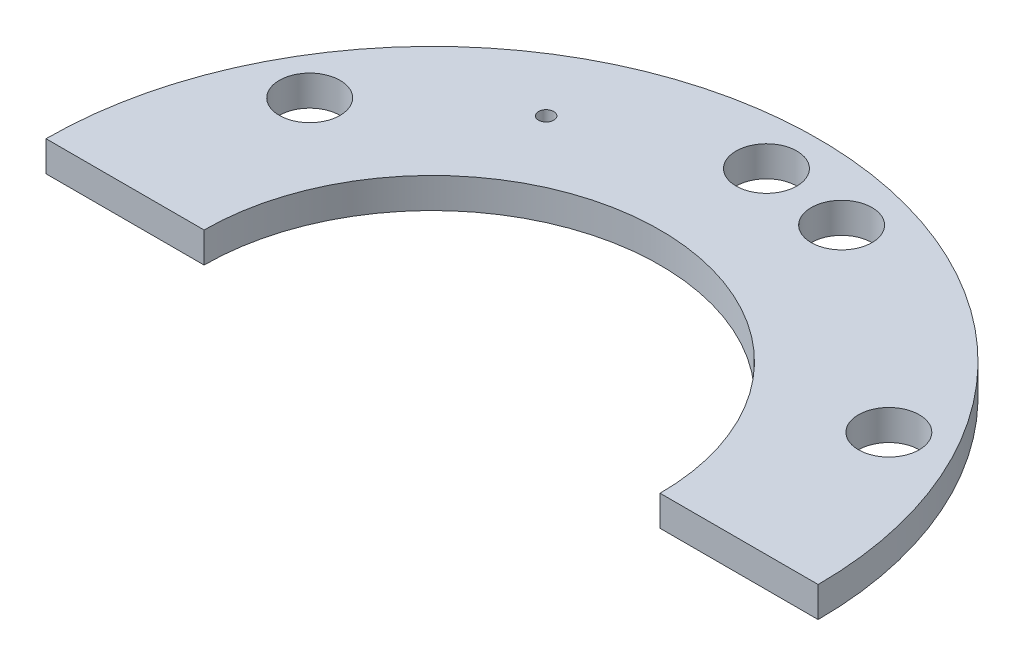
from build123d import *

# Parameters (mm, degrees)
SKETCH1_R               = 12.7
BOSS_EXTRUDE1_DEPTH     = 1
CUT_EXTRUDE1_DEPTH      = 18.98832955
CUT_EXTRUDE1_DEPTH_BACK = 18.98832955
SKETCH19_R              = 1
CUT_EXTRUDE2_DEPTH      = 18.98832955
CUT_EXTRUDE2_DEPTH_BACK = 18.98832955
SKETCH20_R              = 7.5
SKETCH21_W              = 65.874202484
SKETCH21_H              = 51.979273979
CUT_EXTRUDE3_DEPTH      = 18.98832955
CUT_EXTRUDE4_DEPTH      = 18.98832955
CUT_EXTRUDE4_DEPTH_BACK = 18.98832955
SKETCH22_R              = 0.25
SKETCH22_R_2            = 1


with BuildPart() as part:
    # Sketch1 → Boss-Extrude1 (new body)
    with BuildSketch(Plane(origin=(0, 0, 0), x_dir=(1, 0, 0), z_dir=(0, 1, 0))):
        Circle(SKETCH1_R)
    extrude(amount=BOSS_EXTRUDE1_DEPTH)

    # Sketch19 → Cut-Extrude1 (cut, two sides: drawn at the far end of the back side and taken through both)
    with BuildSketch(Plane(origin=(0, 1, 0), x_dir=(1, 0, 0), z_dir=(0, 1, 0)).offset(-CUT_EXTRUDE1_DEPTH_BACK)):
        with Locations((0, 11)):
            Circle(SKETCH19_R)
        with Locations((9.526279442, 5.5)):
            Circle(SKETCH19_R)
        with Locations((9.526279442, -5.5)):
            Circle(SKETCH19_R)
        with Locations((0, -11)):
            Circle(SKETCH19_R)
        with Locations((-9.526279442, -5.5)):
            Circle(SKETCH19_R)
        with Locations((-9.526279442, 5.5)):
            Circle(SKETCH19_R)
    extrude(amount=CUT_EXTRUDE1_DEPTH + CUT_EXTRUDE1_DEPTH_BACK, mode=Mode.SUBTRACT)

    # Sketch20 → Cut-Extrude2 (cut, two sides: drawn at the far end of the back side and taken through both)
    with BuildSketch(Plane(origin=(0, 1, 0), x_dir=(1, 0, 0), z_dir=(0, 1, 0)).offset(-CUT_EXTRUDE2_DEPTH_BACK)):
        Circle(SKETCH20_R)
    extrude(amount=CUT_EXTRUDE2_DEPTH + CUT_EXTRUDE2_DEPTH_BACK, mode=Mode.SUBTRACT)

    # Sketch21 → Cut-Extrude3 (cut, through all)
    with BuildSketch(Plane.XY):
        with Locations((-3.816154381, 6.321647006)):
            Rectangle(SKETCH21_W, SKETCH21_H)
    extrude(amount=CUT_EXTRUDE3_DEPTH, mode=Mode.SUBTRACT)

    # Sketch22 → Cut-Extrude4 (cut, two sides: drawn at the far end of the back side and taken through both)
    with BuildSketch(Plane(origin=(0, 1, 0), x_dir=(1, 0, 0), z_dir=(0, 1, 0)).offset(-CUT_EXTRUDE4_DEPTH_BACK)):
        with Locations((-5.125, 8.876760389)):
            Circle(SKETCH22_R)
        with Locations((2.847009496, 10.625184089)):
            Circle(SKETCH22_R_2)
    extrude(amount=CUT_EXTRUDE4_DEPTH + CUT_EXTRUDE4_DEPTH_BACK, mode=Mode.SUBTRACT)


solid = part.part
